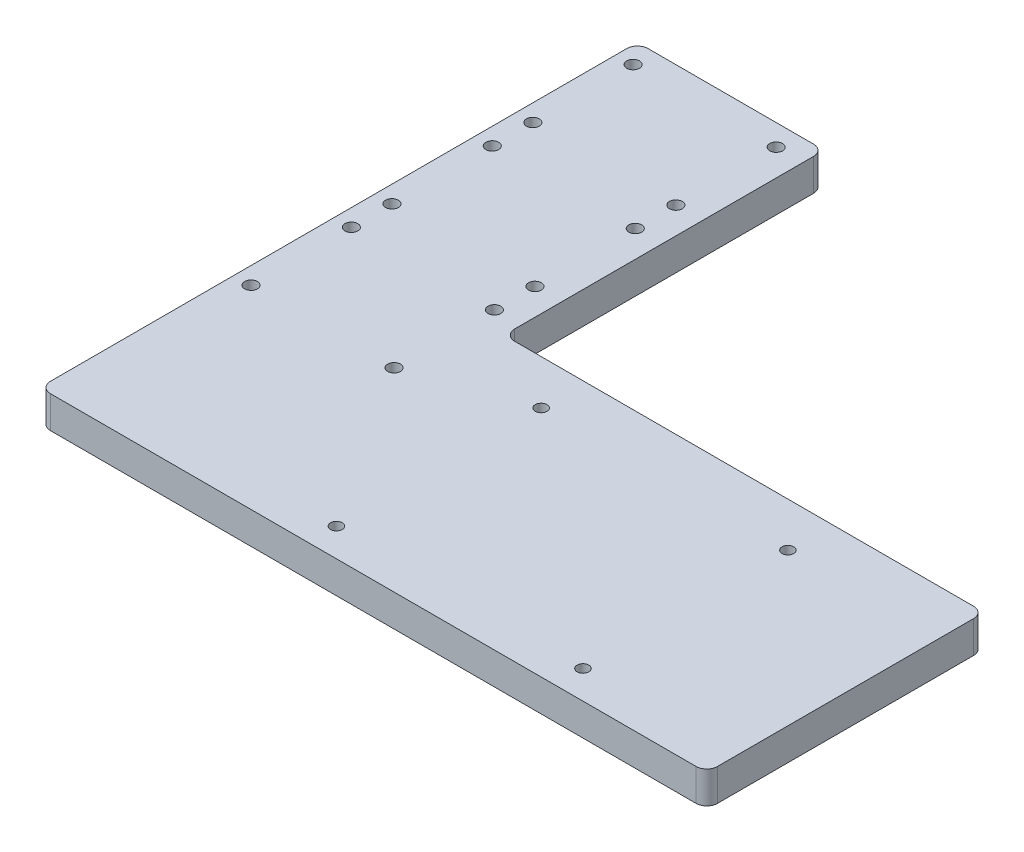
from build123d import *

# Parameters (mm, degrees)
BOSS_EXTRUDE1_DEPTH = 7.62
SKETCH3_R           = 1.397
SKETCH3_R_2         = 1.524
CUT_EXTRUDE1_DEPTH  = 7.62
FILLET1_R           = 2.54
FILLET2_R           = 2.54


with BuildPart() as part:
    # Sketch1 → Boss-Extrude1 (new body)
    with BuildSketch(Plane(origin=(0, 0, 0), x_dir=(1, 0, 0), z_dir=(0, 1, 0))):
        Polygon((6.35, 142.24), (6.35, 66.04), (120.65, 66.04), (120.65, 0), (0, 0), (-38.1, 0), (-38.1, 142.24), align=None)
    extrude(amount=BOSS_EXTRUDE1_DEPTH)

    # Sketch3 → Cut-Extrude1 (cut)
    with BuildSketch(Plane(origin=(0, 7.62, 0), x_dir=(1, 0, 0), z_dir=(0, 1, 0))):
        with Locations((25.781, 6.731)):
            Circle(SKETCH3_R)
        with Locations((25.781, 55.4355)):
            Circle(SKETCH3_R)
        with Locations((84.455, 55.499)):
            Circle(SKETCH3_R)
        with Locations((84.455, 6.731)):
            Circle(SKETCH3_R)
        with Locations((-34.036, 137.16)):
            Circle(SKETCH3_R_2)
        with Locations((0, 137.16)):
            Circle(SKETCH3_R_2)
        with Locations((-34.036, 113.284)):
            Circle(SKETCH3_R_2)
        with Locations((0, 113.284)):
            Circle(SKETCH3_R_2)
        with Locations((-34.036, 103.632)):
            Circle(SKETCH3_R_2)
        with Locations((0, 103.632)):
            Circle(SKETCH3_R_2)
        with Locations((-34.036, 79.756)):
            Circle(SKETCH3_R_2)
        with Locations((0, 79.756)):
            Circle(SKETCH3_R_2)
        with Locations((-34.036, 70.104)):
            Circle(SKETCH3_R_2)
        with Locations((0, 70.104)):
            Circle(SKETCH3_R_2)
        with Locations((-34.036, 46.228)):
            Circle(SKETCH3_R_2)
        with Locations((0, 46.228)):
            Circle(SKETCH3_R_2)
    extrude(amount=-CUT_EXTRUDE1_DEPTH, mode=Mode.SUBTRACT)

    # Fillet1
    fillet1_edges = [part.edges().sort_by_distance(p)[0] for p in [
        (6.35, 3.81, -66.04),
    ]]
    fillet(fillet1_edges, radius=FILLET1_R)

    # Fillet2
    fillet2_edges = [part.edges().sort_by_distance(p)[0] for p in [
        (120.65, 3.81, 0),
        (120.65, 3.81, -66.04),
        (6.35, 3.81, -142.24),
        (-38.1, 3.81, -142.24),
        (-38.1, 3.81, 0),
    ]]
    fillet(fillet2_edges, radius=FILLET2_R)


solid = part.part
